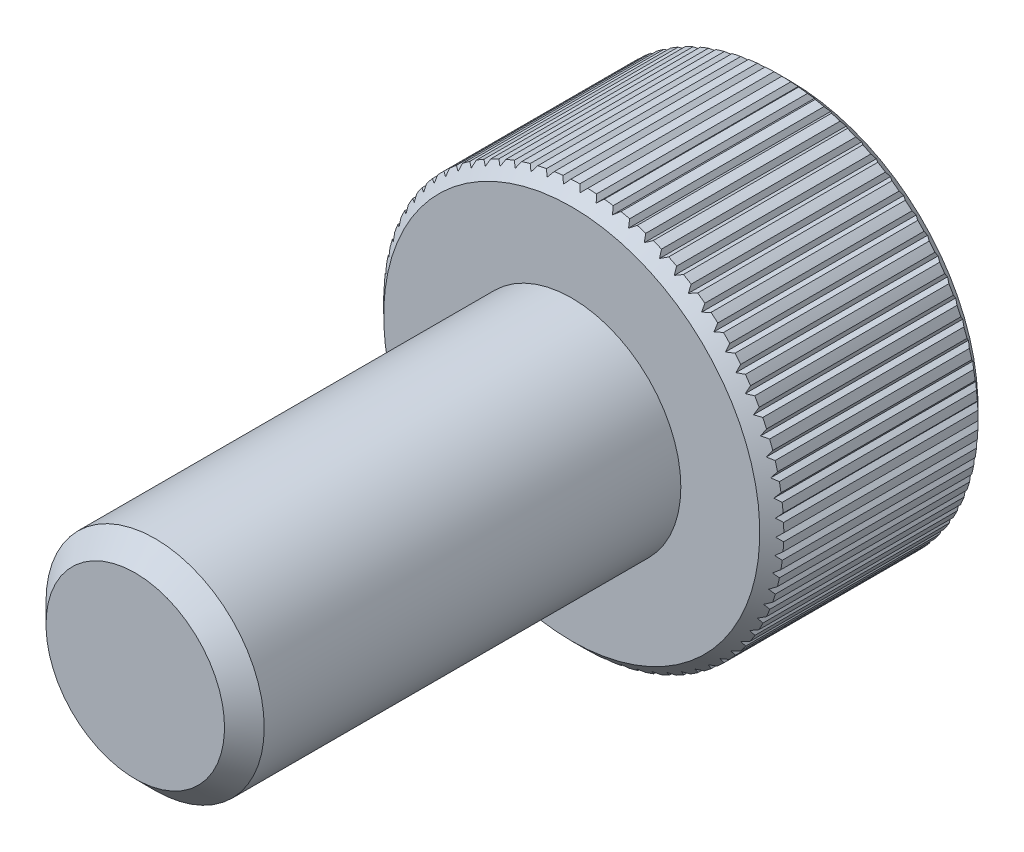
from build123d import *

# Parameters (mm, degrees)
CUT_EXTRUDE1_DEPTH = 1.875
CHAMFER1_SIZE      = 0.165
CHAMFER2_SIZE      = 0.273
CUT_EXTRUDE3_DEPTH = 8.150174823
CIRPATTERN1_COUNT  = 75


with BuildPart() as part:
    # Sketch2 → Revolve1 (revolve)
    with BuildSketch(Plane(origin=(0, 0, 0), x_dir=(0, 0, -1), z_dir=(1, 0, 0))):
        Polygon((3, 2.75), (0, 2.75), (0, 1.5), (-6, 1.5), (-6, 0), (3, 0), align=None)
    revolve(axis=Axis((0, 0, 6), (0, 0, -1)))

    # Sketch4 → Cut-Extrude1 (cut)
    with BuildSketch(Plane(origin=(0, 0, -3), x_dir=(-1, 0, 0), z_dir=(0, 0, -1))):
        Polygon((0, 1.443375673), (-1.25, 0.721687836), (-1.25, -0.721687836), (0, -1.443375673), (1.25, -0.721687836), (1.25, 0.721687836), align=None)
    extrude(amount=-CUT_EXTRUDE1_DEPTH, mode=Mode.SUBTRACT)

    # Cut-Extrude2 cone 1 section (through the dimple's axis) → Cut-Extrude2 (revolve, cut)
    with BuildSketch(Plane(origin=(0, 0, -3), x_dir=(0, 1, 0), z_dir=(1, 0, 0))):
        Polygon((0, 0), (1.443375673, 0), (0, 1.443375673), align=None)
    revolve(axis=Axis((0, 0, -3), (0, 0, 1)), mode=Mode.SUBTRACT)

    # Chamfer1
    chamfer1_edges = [part.edges().sort_by_distance(p)[0] for p in [
        (0, -2.75, 0),
        (0, -2.75, -3),
    ]]
    chamfer(chamfer1_edges, length=CHAMFER1_SIZE)

    # Chamfer2
    chamfer2_edges = [part.edges().sort_by_distance(p)[0] for p in [
        (0, -1.5, 6),
    ]]
    chamfer(chamfer2_edges, length=CHAMFER2_SIZE)


with BuildPart() as body_2:
    # Split1: the piece on the far side of the plane
    add(part.part)
    split(bisect_by=Plane(origin=(0, 2.75, 0), x_dir=(0, -1, 0), z_dir=(0, 0, -1)), keep=Keep.BOTTOM)


with BuildPart() as part_1:
    add(part.part)

    # Split1
    split(bisect_by=Plane(origin=(0, 2.75, 0), x_dir=(0, -1, 0), z_dir=(0, 0, -1)), keep=Keep.TOP)

    add(body_2.part)  # Revolve2 merges body 2
    # Sketch13 → Revolve2 (revolve)
    with BuildSketch(Plane(origin=(0, 0, 0), x_dir=(0, 0, -1), z_dir=(1, 0, 0))):
        Polygon((0.195, 1.5), (0.195, 0), (-2.901071633, 0), (-0.195, 1.5), align=None)
    revolve(axis=Axis((0, 0, -0.195), (0, 0, 1)))

    # Sketch12 → Cut-Extrude3 (cut, through all)
    with BuildSketch(Plane.XY):
        Polygon((-0.054447222, 2.75), (0, 2.804447222), (0.054447222, 2.75), (0, 2.695552778), align=None)
    cut_extrude3 = extrude(amount=-CUT_EXTRUDE3_DEPTH, mode=Mode.SUBTRACT)

    # CirPattern1: Cut-Extrude3 ×75 about axis
    cirpattern1_axis = Axis((0, 0, 0), (0, 0, 1))
    for i in range(1, CIRPATTERN1_COUNT):
        add(cut_extrude3.rotate(cirpattern1_axis, i * 360 / CIRPATTERN1_COUNT), mode=Mode.SUBTRACT)


solid = part_1.part
